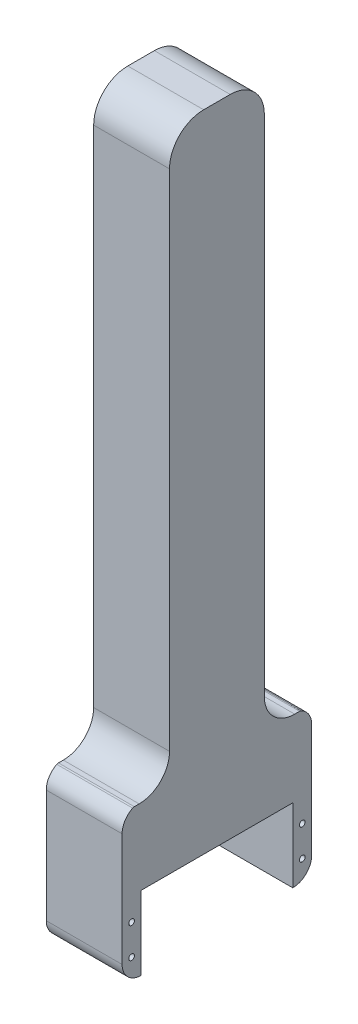
from build123d import *

# Parameters (mm, degrees)
BOSS_EXTRUDE1_DEPTH = 20
SKETCH2_R           = 0.75
CUT_EXTRUDE1_DEPTH  = 140.606785953
CUT_EXTRUDE2_DEPTH  = 140.606785953
FILLET1_R           = 5
FILLET2_R           = 1
FILLET3_R           = 5
FILLET4_R           = 1
SKETCH4_W           = 19.881917645
SKETCH4_H           = 22.757656903
CUT_EXTRUDE3_DEPTH  = 140.606786098
FILLET5_R           = 5
FILLET6_R           = 1
FILLET7_R           = 5
FILLET8_R           = 1


# Some blends are built 0.0001 mm under size
with BuildPart() as part:
    # Sketch1 → Boss-Extrude1 (new body)
    with BuildSketch(Plane(origin=(0, 0, 0), x_dir=(0, 0, -1), z_dir=(1, 0, 0))):
        with BuildLine():
            Line((-39.089147287, -15.953488372), (-39.089147287, 117.046511628))
            ThreePointArc((-39.089147287, 117.046511628), (-36.453108318, 123.410472659), (-30.089147287, 126.046511628))
            Line((-30.089147287, 126.046511628), (-23.089147287, 126.046511628))
            ThreePointArc((-23.089147287, 126.046511628), (-16.725186256, 123.410472659), (-14.089147287, 117.046511628))
            Line((-14.089147287, 117.046511628), (-14.089147287, -15.953488372))
            ThreePointArc((-14.089147287, -15.953488372), (-11.746001536, -21.610342622), (-6.089147287, -23.953488372))
            Line((-6.089147287, -23.953488372), (-4.589147287, -23.953488372))
            ThreePointArc((-4.589147287, -23.953488372), (1.067706963, -26.296634123), (3.410852713, -31.953488372))
            Line((3.410852713, -31.953488372), (3.410852713, -55.953488372))
            ThreePointArc((3.410852713, -55.953488372), (1.067706963, -61.610342622), (-4.589147287, -63.953488372))
            Line((-4.589147287, -63.953488372), (-6.589147287, -63.953488372))
            Line((-6.589147287, -63.953488372), (-6.589147287, -43.953488372))
            Line((-6.589147287, -43.953488372), (-46.589147287, -43.953488372))
            Line((-46.589147287, -43.953488372), (-46.589147287, -63.953488372))
            Line((-46.589147287, -63.953488372), (-48.589147287, -63.953488372))
            ThreePointArc((-48.589147287, -63.953488372), (-54.246001536, -61.610342622), (-56.589147287, -55.953488372))
            Line((-56.589147287, -55.953488372), (-56.589147287, -31.953488372))
            ThreePointArc((-56.589147287, -31.953488372), (-54.246001536, -26.296634123), (-48.589147287, -23.953488372))
            Line((-48.589147287, -23.953488372), (-47.089147287, -23.953488372))
            ThreePointArc((-47.089147287, -23.953488372), (-41.432293037, -21.610342622), (-39.089147287, -15.953488372))
        make_face()
    extrude(amount=BOSS_EXTRUDE1_DEPTH)

    # Sketch2 → Cut-Extrude1 (cut, through all)
    with BuildSketch(Plane.ZY):
        with Locations((4.089147287, -49.953488372)):
            Circle(SKETCH2_R)
        with Locations(Location((4.089147287, -57.953488372, 0), (0, 0, 180))):
            Circle(SKETCH2_R)
        with Locations((49.089147287, -57.953488372)):
            Circle(SKETCH2_R)
        with Locations(Location((49.089147287, -49.953488372, 0), (0, 0, 180))):
            Circle(SKETCH2_R)
    extrude(amount=-CUT_EXTRUDE1_DEPTH, mode=Mode.SUBTRACT)

    # Sketch3 → Cut-Extrude2 (cut, through all)
    with BuildSketch(Plane.ZY):
        with BuildLine():
            Line((1.589147287, -43.953488372), (-3.410852713, -43.953488372))
            Line((-3.410852713, -43.953488372), (-12.995571428, -43.953488372))
            Line((-12.995571428, -43.953488372), (-12.995571428, -71.298292192))
            Line((-12.995571428, -71.298292192), (6.589147287, -71.298292192))
            Line((6.589147287, -71.298292192), (6.589147287, -63.369686859))
            ThreePointArc((6.589147287, -63.369686859), (3.053613381, -61.905220765), (1.589147287, -58.369686859))
            Line((1.589147287, -58.369686859), (1.589147287, -43.953488372))
        make_face()
        with BuildLine():
            Line((46.589147287, -63.369686859), (46.589147287, -71.298292192))
            Line((46.589147287, -71.298292192), (65.185710821, -71.298292192))
            Line((65.185710821, -71.298292192), (65.185710821, -43.953488372))
            Line((65.185710821, -43.953488372), (56.589147287, -43.953488372))
            Line((56.589147287, -43.953488372), (51.589147287, -43.953488372))
            Line((51.589147287, -43.953488372), (51.589147287, -58.369686859))
            ThreePointArc((51.589147287, -58.369686859), (50.124681193, -61.905220765), (46.589147287, -63.369686859))
        make_face()
    extrude(amount=-CUT_EXTRUDE2_DEPTH, mode=Mode.SUBTRACT)

    # Fillet1
    fillet1_edges = [part.edges().sort_by_distance(p)[0] for p in [
        (10, -43.953488372, -3.410852713),
    ]]
    fillet(fillet1_edges, radius=FILLET1_R - 0.0001)  # a hair under: the kernel refuses the full size

    # Fillet2
    fillet2_edges = [part.edges().sort_by_distance(p)[0] for p in [
        (10, -43.953488372, 1.589147287),
    ]]
    fillet(fillet2_edges, radius=FILLET2_R)

    # Fillet3
    fillet3_edges = [part.edges().sort_by_distance(p)[0] for p in [
        (10, -43.953488372, 56.589147287),
    ]]
    fillet(fillet3_edges, radius=FILLET3_R - 0.0001)  # a hair under: the kernel refuses the full size

    # Fillet4
    fillet4_edges = [part.edges().sort_by_distance(p)[0] for p in [
        (10, -43.953488372, 51.589147287),
    ]]
    fillet(fillet4_edges, radius=FILLET4_R)

    # Sketch4 → Cut-Extrude3 (cut, through all)
    with BuildSketch(Plane.ZY):
        with Locations((-8.351811536, -35.916118337)):
            Rectangle(SKETCH4_W, SKETCH4_H)
        Polygon((51.589147287, -47.294946788), (51.589147287, -22.319102336), (73.994526012, -22.319102336), (73.994526012, -45.973763973), align=None)
    extrude(amount=-CUT_EXTRUDE3_DEPTH, mode=Mode.SUBTRACT)

    # Fillet5
    # the kernel refuses this fillet: 5 mm, written as the material it takes off along each edge
    with BuildSketch(Plane(origin=(-9.996935455, -24.537289885, 1.589147287), x_dir=(0, -1, 0), z_dir=(1, 0, 0))) as fillet5_piece_1:
        with BuildLine():
            CenterArc((3.998774182, -5), FILLET5_R, 90, 66.421821522)
            ThreePointArc((-0.583801513, -3), (-0.436494933, -1.4718619), (0, 0))
            Line((0, 0), (3.998774182, 0))
        make_face()
    extrude(amount=39.99387091, mode=Mode.SUBTRACT)

    # Fillet6
    fillet6_edges = [part.edges().sort_by_distance(p)[0] for p in [
        (10, -23.953488372, 4.589147287),
    ]]
    fillet(fillet6_edges, radius=FILLET6_R)

    # Fillet7
    # the kernel refuses this fillet: 5 mm, written as the material it takes off along each edge
    with BuildSketch(Plane(origin=(29.996935455, -24.537289885, 51.589147287), x_dir=(0, -1, 0), z_dir=(-1, 0, 0))) as fillet7_piece_1:
        with BuildLine():
            CenterArc((3.998774182, -5), FILLET7_R, 90, 66.421821522)
            ThreePointArc((-0.583801513, -3), (-0.436494933, -1.4718619), (0, 0))
            Line((0, 0), (3.998774182, 0))
        make_face()
    extrude(amount=39.99387091, mode=Mode.SUBTRACT)

    # Fillet8
    fillet8_edges = [part.edges().sort_by_distance(p)[0] for p in [
        (10, -23.953488372, 48.589147287),
    ]]
    fillet(fillet8_edges, radius=FILLET8_R)


solid = part.part
